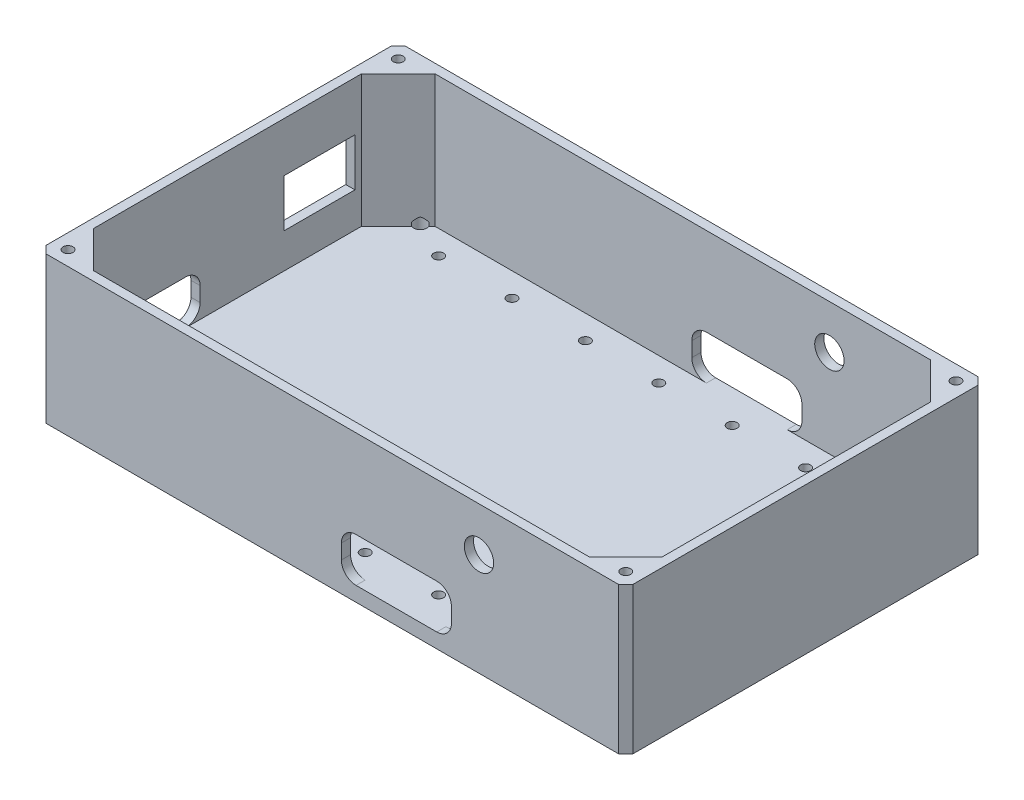
from build123d import *

# Parameters (mm, degrees)
SKETCH1_W                 = 160
SKETCH1_H                 = 98
BOSS_EXTRUDE1_DEPTH       = 40
SHELL1_T                  = -2.5
SHELL1_THICKNESS_2_FACE_W = 93
SHELL1_THICKNESS_2_FACE_H = 155
SHELL1_THICKNESS_2_DEPTH  = 1.5
CHAMFER1_SIZE             = 2
CHAMFER2_SIZE             = 10
HOLE2_START               = 28
HOLE2_OUTLINE_R           = 1.35
HOLE2_DEPTH               = 12
HOLE3_D                   = 2.7
MIRROR2_COPY_1_D          = 2.7
CUT_EXTRUDE2_REACH        = 174.049
SKETCH15_W                = 19.4
SKETCH15_H                = 13
CUT_EXTRUDE3_REACH        = 174.049
SKETCH16_W                = 20
SKETCH16_H                = 12
FILLET4_R                 = 4
SKETCH17_R                = 4
CUT_EXTRUDE4_DEPTH        = 133.680066325
SKETCH20_W                = 30
SKETCH20_H                = 12
CUT_EXTRUDE5_DEPTH        = 157.939807062
FILLET6_R                 = 4


# Read off the part's stored shape, not the designer's step: Hole1, Hole2
with BuildPart() as part:
    # Sketch1 → Boss-Extrude1 (new body)
    with BuildSketch(Plane(origin=(0, 0, 0), x_dir=(1, 0, 0), z_dir=(0, 1, 0))):
        Rectangle(SKETCH1_W, SKETCH1_H)
    extrude(amount=BOSS_EXTRUDE1_DEPTH)

    # Shell1
    shell1_openings = [part.faces().sort_by_distance(p)[0] for p in [
        (0, 40, 0),
    ]]
    offset(amount=SHELL1_T, openings=shell1_openings, kind=Kind.INTERSECTION)

    # Shell1 thickness 2 face (on inner face of the shell) → Shell1 thickness 2 (add)
    with BuildSketch(Plane(origin=(0, 2.5, 0), x_dir=(0, 0, -1), z_dir=(0, -1, 0))):
        Rectangle(SHELL1_THICKNESS_2_FACE_W, SHELL1_THICKNESS_2_FACE_H)
    extrude(amount=-SHELL1_THICKNESS_2_DEPTH)

    # Chamfer1
    chamfer1_edges = [part.edges().sort_by_distance(p)[0] for p in [
        (80, 20, 49),
        (-80, 20, 49),
        (-80, 20, -49),
        (80, 20, -49),
    ]]
    chamfer(chamfer1_edges, length=CHAMFER1_SIZE)

    # Chamfer2
    chamfer2_edges = [part.edges().sort_by_distance(p)[0] for p in [
        (77.5, 22, 46.5),
        (77.5, 22, -46.5),
        (-77.5, 22, -46.5),
        (-77.5, 22, 46.5),
    ]]
    chamfer(chamfer2_edges, length=CHAMFER2_SIZE)

    # Hole1 outline → Hole1 (revolve, cut)
    with BuildSketch(Plane(origin=(-70, 0, 45), x_dir=(1, 0, 0), z_dir=(0, 0, 1))):
        Polygon((1.85, 0), (1.85, 5), (0, 6.85), (0, 0), align=None)
    revolve(axis=Axis((-70, 0, 45), (0, 1, 0)), mode=Mode.SUBTRACT)

    # Hole1 2 outline → Hole1 2 (revolve, cut)
    with BuildSketch(Plane(origin=(70, 0, -45), x_dir=(1, 0, 0), z_dir=(0, 0, 1))):
        Polygon((1.85, 0), (1.85, 5), (0, 6.85), (0, 0), align=None)
    revolve(axis=Axis((70, 0, -45), (0, 1, 0)), mode=Mode.SUBTRACT)

    # Hole1 3 outline → Hole1 3 (revolve, cut)
    with BuildSketch(Plane(origin=(70, 0, 45), x_dir=(1, 0, 0), z_dir=(0, 0, 1))):
        Polygon((1.85, 0), (1.85, 5), (0, 6.85), (0, 0), align=None)
    revolve(axis=Axis((70, 0, 45), (0, 1, 0)), mode=Mode.SUBTRACT)

    # Hole1 4 outline → Hole1 4 (revolve, cut)
    with BuildSketch(Plane(origin=(-70, 0, -45), x_dir=(1, 0, 0), z_dir=(0, 0, 1))):
        Polygon((1.85, 0), (1.85, 5), (0, 6.85), (0, 0), align=None)
    revolve(axis=Axis((-70, 0, -45), (0, 1, 0)), mode=Mode.SUBTRACT)

    # Hole2 outline → Hole2 (cut)
    with BuildSketch(Plane(origin=(0, 0, 0), x_dir=(1, 0, 0), z_dir=(0, 1, 0)).offset(HOLE2_START)):
        with Locations((76, -45)):
            Circle(HOLE2_OUTLINE_R)
        with Locations((-76, 45)):
            Circle(HOLE2_OUTLINE_R)
        with Locations((-76, -45)):
            Circle(HOLE2_OUTLINE_R)
        with Locations((76, 45)):
            Circle(HOLE2_OUTLINE_R)
    extrude(amount=HOLE2_DEPTH, mode=Mode.SUBTRACT)

    # Hole3 (through all)
    with Locations(Plane(origin=(0, 4, 0), x_dir=(1, 0, 0), z_dir=(0, 1, 0))):
        with Locations((60, -40), (0, -40), (20, -40), (40, -40)):
            hole3 = Hole(HOLE3_D / 2)

    # Mirror1: Hole3 across plane
    add(hole3.mirror(Plane(origin=(0, 0, 0), x_dir=(0, 0, 1), z_dir=(1, 0, 0))), mode=Mode.SUBTRACT)

    # Mirror2: Hole3 across plane
    add(hole3.mirror(Plane.XY), mode=Mode.SUBTRACT)

    # Mirror2 copy 1 (through all)
    with Locations(Plane(origin=(0, 4, 0), x_dir=(-1, 0, 0), z_dir=(0, 1, 0))):
        with Locations((60, -40), (0, -40), (20, -40), (40, -40)):
            Hole(MIRROR2_COPY_1_D / 2)

    # Sketch15 → Cut-Extrude2 (cut, up to next)
    with BuildSketch(Plane.ZY.offset(80), mode=Mode.PRIVATE) as cut_extrude2_sk1:
        with Locations((-25, 20)):
            Rectangle(SKETCH15_W, SKETCH15_H)
    cut_extrude2_tool1 = extrude(cut_extrude2_sk1.sketch, amount=-CUT_EXTRUDE2_REACH, mode=Mode.PRIVATE) & part.part
    add(cut_extrude2_tool1.solids().sort_by_distance((-80, 20, -25))[0], mode=Mode.SUBTRACT)

    # Sketch16 → Cut-Extrude3 (cut, up to next)
    with BuildSketch(Plane.ZY.offset(80), mode=Mode.PRIVATE) as cut_extrude3_sk1:
        with Locations((17.5, 10)):
            Rectangle(SKETCH16_W, SKETCH16_H)
    cut_extrude3_tool1 = extrude(cut_extrude3_sk1.sketch, amount=-CUT_EXTRUDE3_REACH, mode=Mode.PRIVATE) & part.part
    add(cut_extrude3_tool1.solids().sort_by_distance((-80, 10, 17.5))[0], mode=Mode.SUBTRACT)

    # Fillet4
    fillet4_edges = [part.edges().sort_by_distance(p)[0] for p in [
        (-78.75, 16, 7.5),
        (-78.75, 4, 7.5),
        (-78.75, 4, 27.5),
        (-78.75, 16, 27.5),
    ]]
    fillet(fillet4_edges, radius=FILLET4_R)

    # Sketch17 → Cut-Extrude4 (cut, through all)
    with BuildSketch(Plane.XY.offset(49)):
        with Locations((40, 28)):
            Circle(SKETCH17_R)
    extrude(amount=-CUT_EXTRUDE4_DEPTH, mode=Mode.SUBTRACT)

    # Sketch20 → Cut-Extrude5 (cut, through all)
    with BuildSketch(Plane(origin=(35.971952471, 0.293460479, 49), x_dir=(1, 0, 0), z_dir=(0, 0, 1))):
        with Locations((-18.471952471, 9.706539521)):
            Rectangle(SKETCH20_W, SKETCH20_H)
    extrude(amount=-CUT_EXTRUDE5_DEPTH, mode=Mode.SUBTRACT)

    # Fillet6
    fillet6_edges = [part.edges().sort_by_distance(p)[0] for p in [
        (2.5, 16, -47.75),
        (32.5, 16, -47.75),
        (2.5, 4, -47.75),
        (32.5, 4, -47.75),
        (32.5, 4, 47.75),
        (32.5, 16, 47.75),
        (2.5, 4, 47.75),
        (2.5, 16, 47.75),
    ]]
    fillet(fillet6_edges, radius=FILLET6_R)


solid = part.part
